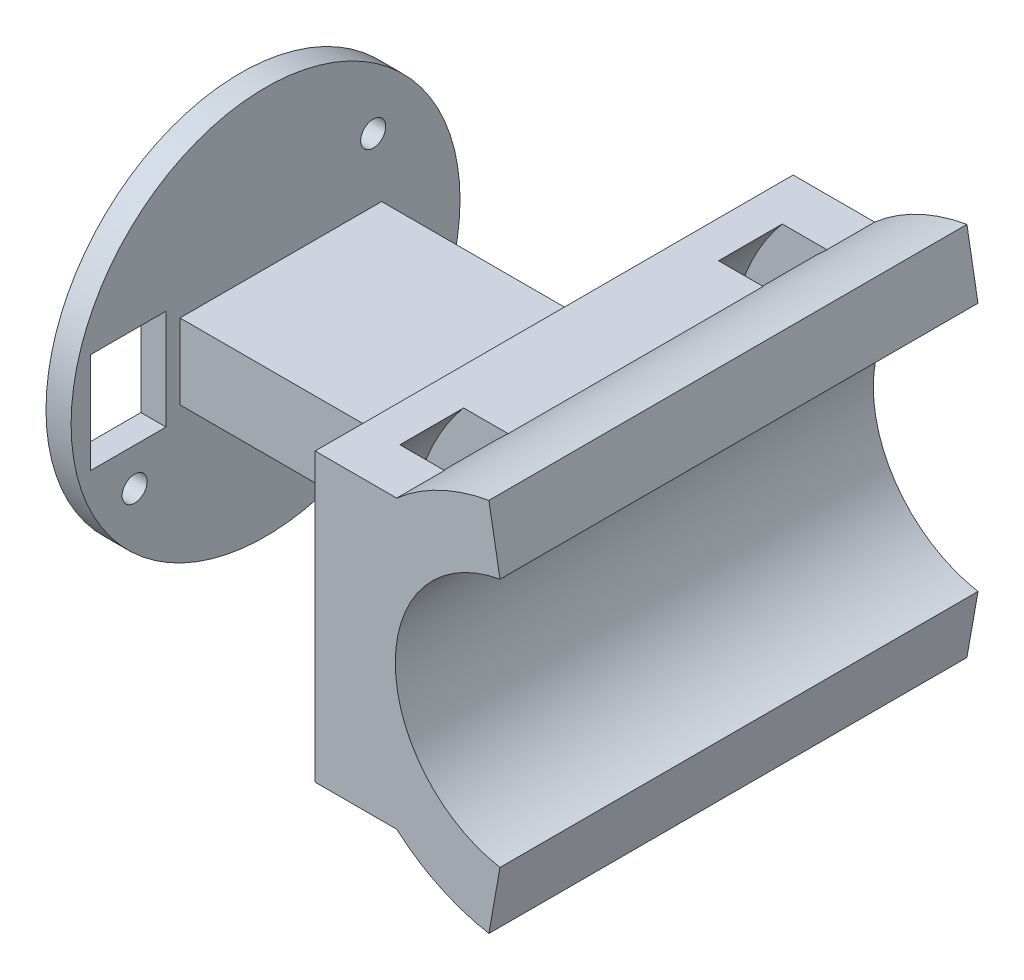
from build123d import *

# Parameters (mm, degrees)
BOSS_EXTRUDE1_DEPTH = 19.05
SKETCH6_W           = 16.071399664
SKETCH6_H           = 6
BOSS_EXTRUDE3_DEPTH = 23
SKETCH3_W           = 2.54
SKETCH3_H           = 5.08
SKETCH4_R           = 15.5
SKETCH4_R_2         = 1
SKETCH4_W           = 8
SKETCH4_H           = 6
BOSS_EXTRUDE2_DEPTH = 2


with BuildPart() as part:
    # Sketch1 → Boss-Extrude1 (new, symmetric)
    with BuildSketch(Plane.XY):
        with BuildLine():
            Line((8.346153406, -9.946558305), (7.464020663, -14.949381691))
            ThreePointArc((7.464020663, -14.949381691), (3.546652059, -13.692553844), (0.110630651, -11.43))
            Line((0.110630651, -11.43), (-6.389369349, -11.43))
            Line((-6.389369349, -11.43), (-6.389369349, 11.43))
            Line((-6.389369349, 11.43), (0.110630651, 11.43))
            ThreePointArc((0.110630651, 11.43), (3.546652059, 13.692553844), (7.464020663, 14.949381691))
            Line((7.464020663, 14.949381691), (8.346153406, 9.946558305))
            ThreePointArc((8.346153406, 9.946558305), (0, 0), (8.346153406, -9.946558305))
        make_face()
    extrude(amount=BOSS_EXTRUDE1_DEPTH, both=True)

    # Sketch6 → Boss-Extrude3 (add)
    with BuildSketch(Plane.ZY.offset(6.389369349)):
        with Locations((-1.213689559, 0)):
            Rectangle(SKETCH6_W, SKETCH6_H)
    extrude(amount=BOSS_EXTRUDE3_DEPTH)

    # Sketch3 → Cut-Revolve1 (revolve, cut)
    with BuildSketch(Plane(origin=(0, 0, 0), x_dir=(1, 0, 0), z_dir=(0, 1, 0))):
        with Locations((-6.35, 12.7)):
            Rectangle(SKETCH3_W, SKETCH3_H)
        with Locations((-6.35, -12.7)):
            Rectangle(SKETCH3_W, SKETCH3_H)
    revolve(axis=Axis((10.1, 0, 19.05), (0, 0, -1)), mode=Mode.SUBTRACT)

    # Sketch4 → Boss-Extrude2 (add)
    with BuildSketch(Plane(origin=(-29.389369349, 0, 0), x_dir=(0, -1, 0), z_dir=(-1, 0, 0))):
        Circle(SKETCH4_R)
        with Locations((6.97426488, 10.435972737)):
            Circle(SKETCH4_R_2, mode=Mode.SUBTRACT)
        with Locations((-8.02573512, -8.580948715)):
            Circle(SKETCH4_R_2, mode=Mode.SUBTRACT)
        with Locations((-0.025715642, 10.93618237)):
            Rectangle(SKETCH4_W, SKETCH4_H, mode=Mode.SUBTRACT)
    extrude(amount=BOSS_EXTRUDE2_DEPTH)


solid = part.part
